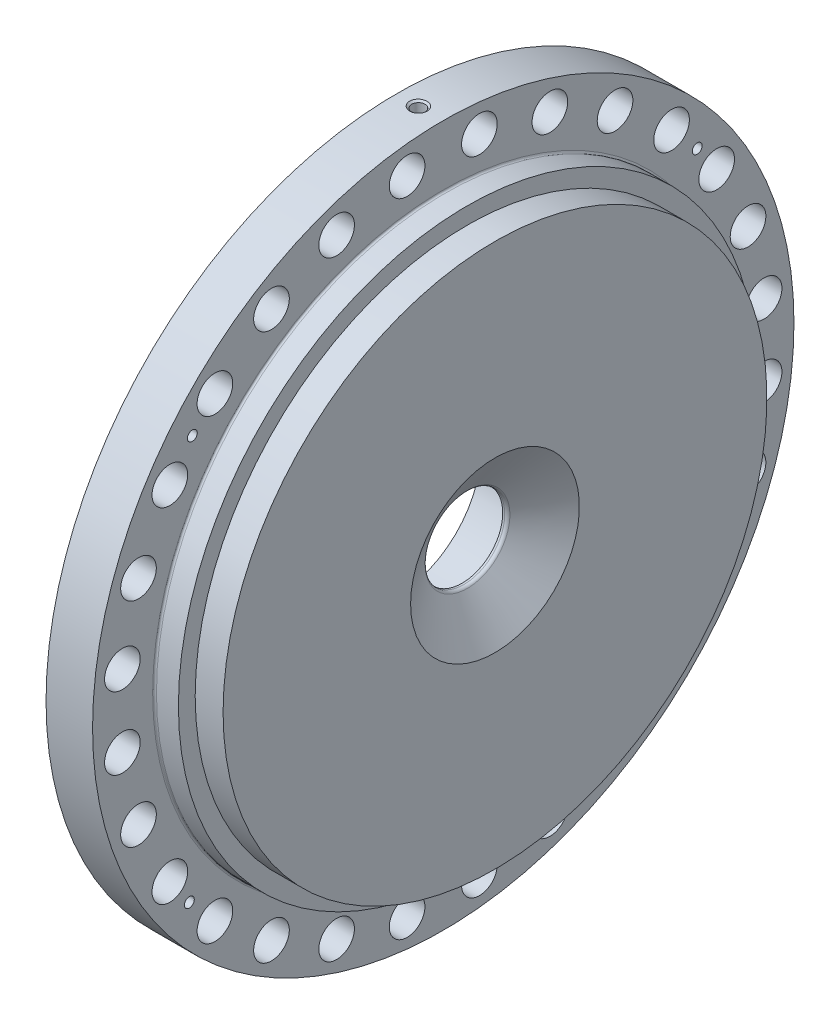
from build123d import *

# Parameters (mm, degrees)
SKETCH4_R                         = 14.2875
CUT_EXTRUDE1_DEPTH                = 406.190469782
CIRPATTERN2_COUNT                 = 28
CIRPATTERN3_COUNT                 = 12
CIRPATTERN4_COUNT                 = 4
CIRPATTERN5_COUNT                 = 56
F_1_2_13_TAPPED_HOLE4_D           = 10.71626
F_1_2_13_TAPPED_HOLE4_DEPTH       = 35.052
F_1_2_13_TAPPED_HOLE4_CSINK_D     = 13.97
F_1_2_13_TAPPED_HOLE4_CSINK_ANGLE = 100
F_1_2_13_TAPPED_HOLE4_TIP         = 3.219489309
FILLET1_R                         = 1.524
FILLET2_R                         = 4.7752
FILLET3_R                         = 1.524


with BuildPart() as part:
    # Sketch1 → Revolve1 (revolve)
    with BuildSketch(Plane.XY, mode=Mode.PRIVATE) as revolve1_sk:
        with BuildLine():
            Line((-4.7752, 67.5132), (-4.7752, 180.9496))
            Line((-4.7752, 180.9496), (0, 180.9496))
            Line((0, 180.9496), (0, 228.9937))
            Line((0, 228.9937), (-4.7752, 228.9937))
            Line((-4.7752, 228.9937), (-4.7752, 281.051))
            Line((-4.7752, 281.051), (32.512, 281.051))
            Line((32.512, 281.051), (32.512, 231.3686))
            Line((32.512, 231.3686), (51.6128, 231.3686))
            Line((51.6128, 231.3686), (51.6128, 217.9066))
            Line((51.6128, 217.9066), (73.9648, 217.9066))
            Line((73.9648, 217.9066), (73.9648, 67.6275))
            Line((73.9648, 67.6275), (51.892823931, 33.9957528))
            ThreePointArc((51.892823931, 33.9957528), (50.746661337, 32.943911593), (49.238413158, 32.5628))
            Line((49.238413158, 32.5628), (47.625, 32.5628))
            Line((47.625, 32.5628), (47.625, 67.5132))
            Line((47.625, 67.5132), (-4.7752, 67.5132))
        make_face()
    revolve(revolve1_sk.sketch.rotate(Axis((0, 0, 0), (1, 0, 0)), 90), axis=Axis((0, 0, 0), (1, 0, 0)))

    # Sketch4 → Cut-Extrude1 (cut, through all)
    with BuildSketch(Plane.ZY.offset(4.7752)):
        with Locations((28.972111579, 257.135466548)):
            Circle(SKETCH4_R)
    cut_extrude1 = extrude(amount=-CUT_EXTRUDE1_DEPTH, mode=Mode.SUBTRACT)

    # CirPattern2: Cut-Extrude1 ×28 about axis
    cirpattern2_axis = Axis((0, 0, 0), (1, 0, 0))
    for i in range(1, CIRPATTERN2_COUNT):
        add(cut_extrude1.rotate(cirpattern2_axis, i * 360 / CIRPATTERN2_COUNT), mode=Mode.SUBTRACT)

    # Sketch8 → 3/4-10 Tapped Hole1 (revolve, cut)
    with BuildSketch(Plane(origin=(0, 199.3429424, 53.413780433), x_dir=(0, 0, 1), z_dir=(0, 1, 0))):
        Polygon((0, 0), (0, 30.407416175), (8.33374, 25.4), (8.33374, 1.82626), (10.16, 0), align=None)
    f_3_4_10_tapped_hole1 = revolve(axis=Axis((-6.35, 199.3429424, 53.413780433), (1, 0, 0)), mode=Mode.SUBTRACT)

    # CirPattern3: 3/4-10 Tapped Hole1 ×12 about axis
    cirpattern3_axis = Axis((0, 0, 0), (1, 0, 0))
    for i in range(1, CIRPATTERN3_COUNT):
        add(f_3_4_10_tapped_hole1.rotate(cirpattern3_axis, i * 360 / CIRPATTERN3_COUNT), mode=Mode.SUBTRACT)

    # Sketch10 → 7/8-9 Tapped Hole1 (revolve, cut)
    with BuildSketch(Plane(origin=(-4.7752, 67.172315786, 67.172315786), x_dir=(0, 0, 1), z_dir=(0, 1, 0))):
        Polygon((0, 0), (0, 31.242239902), (9.72312, 25.4), (9.72312, 2.02438), (11.7475, 0), align=None)
    f_7_8_9_tapped_hole1 = revolve(axis=Axis((-11.1252, 67.172315786, 67.172315786), (1, 0, 0)), mode=Mode.SUBTRACT)

    # CirPattern4: 7/8-9 Tapped Hole1 ×4 about axis
    cirpattern4_axis = Axis((0, 0, 0), (1, 0, 0))
    for i in range(1, CIRPATTERN4_COUNT):
        add(f_7_8_9_tapped_hole1.rotate(cirpattern4_axis, i * 360 / CIRPATTERN4_COUNT), mode=Mode.SUBTRACT)

    # Sketch21 → Tap Drill for 3/8-16 Tap1 (revolve, cut)
    with BuildSketch(Plane(origin=(-4.7752, 162.844517689, 201.096231852), x_dir=(0, 0, 1), z_dir=(0, 1, 0))):
        Polygon((0, 0), (0, 43.024665582), (3.96875, 40.64), (3.96875, 0.635), (4.60375, 0), align=None)
    tap_drill_for_3_8_16_tap1 = revolve(axis=Axis((-11.1252, 162.844517689, 201.096231852), (1, 0, 0)), mode=Mode.SUBTRACT)

    # CirPattern5: Tap Drill for 3/8-16 Tap1 ×56 about axis, 52 skipped
    cirpattern5_axis = Axis((0, 0, 0), (-1, 0, 0))
    add([tap_drill_for_3_8_16_tap1.rotate(cirpattern5_axis, i * 360 / CIRPATTERN5_COUNT) for i in range(1, CIRPATTERN5_COUNT) if i not in (1, 2, 3, 4, 5, 6, 7, 8, 9, 10, 11, 12, 13, 14, 15, 17, 18, 19, 20, 21, 22, 23, 24, 25, 26, 27, 29, 30, 31, 32, 33, 34, 35, 36, 37, 38, 39, 40, 41, 42, 43, 45, 46, 47, 48, 49, 50, 51, 52, 53, 54, 55)], mode=Mode.SUBTRACT)

    # 1/2-13 Tapped Hole4
    with Locations(Plane(origin=(12.5984, 281.051, 0), x_dir=(0, 0, 1), z_dir=(0, 1, 0))):
        with Locations((0, 0)):
            CounterSinkHole(F_1_2_13_TAPPED_HOLE4_D / 2, F_1_2_13_TAPPED_HOLE4_CSINK_D / 2, depth=F_1_2_13_TAPPED_HOLE4_DEPTH, counter_sink_angle=F_1_2_13_TAPPED_HOLE4_CSINK_ANGLE)
            with Locations((0, 0, -(F_1_2_13_TAPPED_HOLE4_DEPTH + F_1_2_13_TAPPED_HOLE4_TIP / 2))):  # 118° drill point
                Cone(0, F_1_2_13_TAPPED_HOLE4_D / 2, F_1_2_13_TAPPED_HOLE4_TIP, mode=Mode.SUBTRACT)

    # Fillet1
    fillet1_edges = [part.edges().sort_by_distance(p)[0] for p in [
        (32.512, 0, -231.3686),
    ]]
    fillet(fillet1_edges, radius=FILLET1_R)

    # Fillet2
    fillet2_edges = [part.edges().sort_by_distance(p)[0] for p in [
        (0, 0, -228.9937),
    ]]
    fillet(fillet2_edges, radius=FILLET2_R - 0.0001)  # a hair under: the kernel refuses the full size

    # Fillet3
    fillet3_edges = [part.edges().sort_by_distance(p)[0] for p in [
        (0, 0, -180.9496),
    ]]
    fillet(fillet3_edges, radius=FILLET3_R)


solid = part.part
